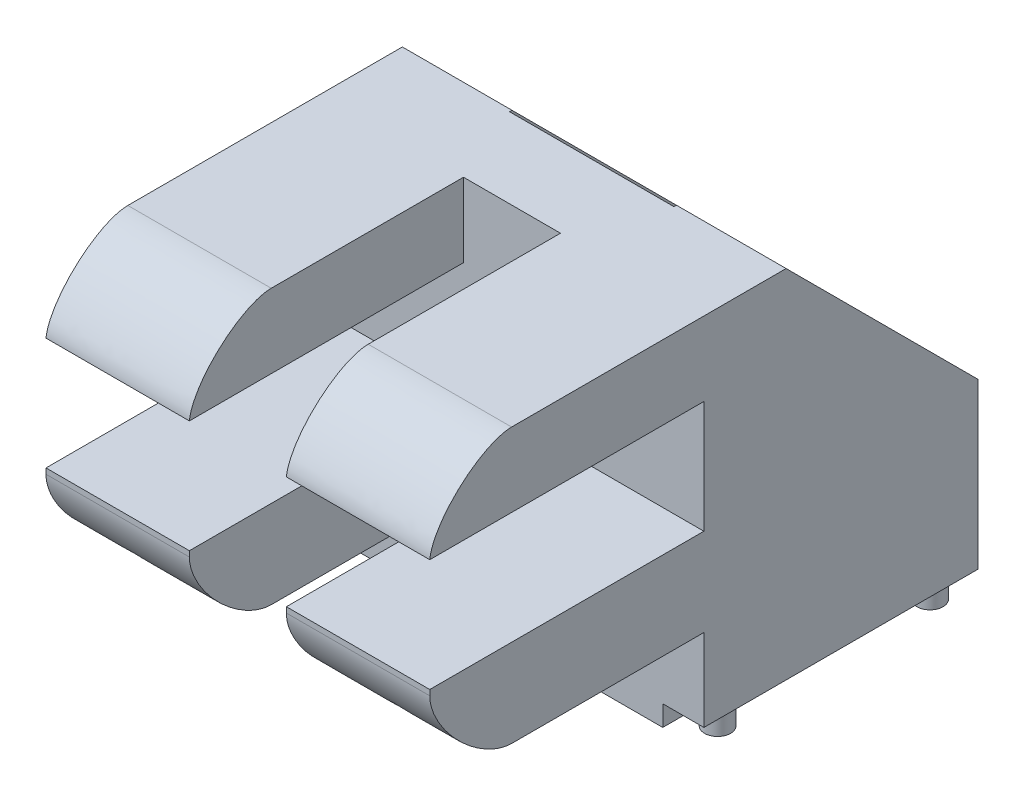
from build123d import *

# Parameters (mm, degrees)
ESQUISSE1_W             = 28
ESQUISSE1_H             = 20
BOSS_EXTRU_1_DEPTH      = 6
ESQUISSE3_W             = 12
ESQUISSE3_H             = 7
ENL_V_MAT_EXTRU_1_DEPTH = 35.928498393
ESQUISSE4_W             = 22
ESQUISSE4_H             = 3
BOSS_EXTRU_2_DEPTH      = 1.5
ESQUISSE5_R             = 0.95
BOSS_EXTRU_3_DEPTH      = 1.9
ESQUISSE6_R             = 0.95
BOSS_EXTRU_4_DEPTH      = 1.9
ESQUISSE12_W            = 28
ESQUISSE12_H            = 5.816034141
BOSS_EXTRU_5_DEPTH      = 20
ESQUISSE13_W            = 8
ESQUISSE13_H            = 14.813855777
BOSS_EXTRU_7_DEPTH      = 20
CHANFREIN4_SIZE         = 14
ESQUISSE15_W            = 10.461102818
ESQUISSE15_H            = 20
BOSS_EXTRU_8_DEPTH      = 20
ESQUISSE16_W            = 10.461102818
ESQUISSE16_H            = 8.2
ENL_V_MAT_EXTRU_2_DEPTH = 20
CONG_3_SIZE             = 6
CONG_4_START            = -29
CONG_4_DEPTH            = 11.461102818
SYM_TRIE3_START         = -8
SYM_TRIE3_DEPTH         = 8
SYM_TRIE3_START_2       = -10.461102818
SYM_TRIE3_2_DEPTH       = 2.461102818


with BuildPart() as part:
    # Esquisse1 → Boss.-Extru.1 (new body)
    with BuildSketch(Plane(origin=(0, 8, 0), x_dir=(1, 0, 0), z_dir=(0, 1, 0))):
        with Locations((-14, -10)):
            Rectangle(ESQUISSE1_W, ESQUISSE1_H)
    extrude(amount=BOSS_EXTRU_1_DEPTH)

    # Esquisse3 → Enlèv. mat.-Extru.1 (cut, through all)
    with BuildSketch(Plane(origin=(0, 14, 0), x_dir=(1, 0, 0), z_dir=(0, 1, 0))):
        with Locations((-14, -10.5)):
            Rectangle(ESQUISSE3_W, ESQUISSE3_H)
    extrude(amount=-ENL_V_MAT_EXTRU_1_DEPTH, mode=Mode.SUBTRACT)

    # Esquisse4 → Boss.-Extru.2 (add)
    with BuildSketch(Plane.XZ.offset(-8)):
        with Locations((-14, 18.5)):
            Rectangle(ESQUISSE4_W, ESQUISSE4_H)
    extrude(amount=BOSS_EXTRU_2_DEPTH)

    # Esquisse5 → Boss.-Extru.3 (add)
    with BuildSketch(Plane.XZ.offset(-8)):
        with Locations(Location((-1.75, 1.75, 0), (0, 0, 90))):
            Circle(ESQUISSE5_R)
    boss_extru_3 = extrude(amount=BOSS_EXTRU_3_DEPTH)

    # Esquisse6 → Boss.-Extru.4 (add)
    with BuildSketch(Plane.XZ.offset(-8)):
        with Locations(Location((-1.5, 17.5, 0), (0, 0, 90))):
            Circle(ESQUISSE6_R)
    boss_extru_4 = extrude(amount=BOSS_EXTRU_4_DEPTH)

    # Symétrie2: Boss.-Extru.3, Boss.-Extru.4 across plane
    add(boss_extru_3.mirror(Plane(origin=(-14, 0, 0), x_dir=(0, 0, 1), z_dir=(1, 0, 0))))
    add(boss_extru_4.mirror(Plane(origin=(-14, 0, 0), x_dir=(0, 0, 1), z_dir=(1, 0, 0))))

    # Esquisse12 → Boss.-Extru.5 (add)
    with BuildSketch(Plane(origin=(0, 14, 0), x_dir=(1, 0, 0), z_dir=(0, 1, 0))):
        with Locations((-14, -17.091982929)):
            Rectangle(ESQUISSE12_W, ESQUISSE12_H)
    extrude(amount=BOSS_EXTRU_5_DEPTH)

    # Esquisse13 → Boss.-Extru.7 (add)
    with BuildSketch(Plane(origin=(0, 14, 0), x_dir=(1, 0, 0), z_dir=(0, 1, 0))):
        with Locations((-24, -7.406927889)):
            Rectangle(ESQUISSE13_W, ESQUISSE13_H)
    extrude(amount=BOSS_EXTRU_7_DEPTH)

    # Chanfrein4
    chanfrein4_edges = [part.edges().sort_by_distance(p)[0] for p in [
        (-24, 34, 0),
    ]]
    chamfer(chanfrein4_edges, length=CHANFREIN4_SIZE)

    # Esquisse15 → Boss.-Extru.8 (add)
    with BuildSketch(Plane.XY.offset(20)):
        with Locations((-22.769448591, 24)):
            Rectangle(ESQUISSE15_W, ESQUISSE15_H)
    extrude(amount=BOSS_EXTRU_8_DEPTH)

    # Esquisse16 → Enlèv. mat.-Extru.2 (cut)
    with BuildSketch(Plane.XY.offset(40)):
        with Locations((-22.769448591, 24.5)):
            Rectangle(ESQUISSE16_W, ESQUISSE16_H)
    extrude(amount=-ENL_V_MAT_EXTRU_2_DEPTH, mode=Mode.SUBTRACT)

    # Congé3
    # a fillet whose section is not a circle: 6 mm, written as the material it takes off along each edge
    with BuildSketch(Plane(origin=(-2.538897182, 14, 40), x_dir=(0, 1, 0), z_dir=(-1, 0, 0))) as cong_3_piece_1:
        with BuildLine():
            Bezier((CONG_3_SIZE, 0), (0, 0), (0, CONG_3_SIZE), weights=[1, 0.424264069, 1])
            Line((0, CONG_3_SIZE), (0, 0))
            Line((0, 0), (CONG_3_SIZE, 0))
        make_face()
    extrude(amount=40.461102818, mode=Mode.SUBTRACT)

    # Congé4: read off the stored shape, not the designer's step
    # Congé4 outline → Congé4 (cut)
    with BuildSketch(Plane.YZ.offset(CONG_4_START)):
        with BuildLine():
            add(Edge.make_bspline(
                [(34, 34.030075377), (34, 39.45727958), (28.6, 40)],
                knots=[0, 0, 0, 1, 1, 1], degree=2, weights=[1, 0.444971909, 1]))
            Line((34, 34.030075377), (34, 40))
            Line((34, 40), (28.6, 40))
        make_face()
    extrude(amount=CONG_4_DEPTH, mode=Mode.SUBTRACT)

    # Symétrie3: read off the stored shape, not the designer's step
    # Symétrie3 outline → Symétrie3 (add)
    with BuildSketch(Plane.YZ.offset(SYM_TRIE3_START)):
        Polygon((34, 14), (34, 14.183965859), (14, 14.183965859), (14, 0), (20, 0), align=None)
        with BuildLine():
            Line((28.6, 40), (28.6, 20))
            Line((28.6, 20), (34, 20))
            Line((34, 20), (34, 34.030075377))
            add(Edge.make_bspline(
                [(28.6, 40), (34, 39.45727958), (34, 34.030075377)],
                knots=[0, 0, 0, 1, 1, 1], degree=2, weights=[1, 0.444971909, 1]))
        make_face()
        with BuildLine():
            add(Edge.make_bspline(
                [(14, 34), (14, 40), (20, 40)],
                knots=[0, 0, 0, 1, 1, 1], degree=2, weights=[1, 0.424264069, 1]))
            Line((14, 34), (14, 20))
            Line((14, 20), (20.4, 20))
            Line((20.4, 20), (20.4, 40))
            Line((20.4, 40), (20, 40))
        make_face()
    extrude(amount=SYM_TRIE3_DEPTH)

    # Sym_trie3 2 outline → Sym_trie3 2 (add)
    with BuildSketch(Plane.YZ.offset(SYM_TRIE3_START_2)):
        with BuildLine():
            Line((28.6, 40), (28.6, 20))
            Line((28.6, 20), (34, 20))
            Line((34, 20), (34, 34.030075377))
            add(Edge.make_bspline(
                [(28.6, 40), (34, 39.45727958), (34, 34.030075377)],
                knots=[0, 0, 0, 1, 1, 1], degree=2, weights=[1, 0.444971909, 1]))
        make_face()
        with BuildLine():
            add(Edge.make_bspline(
                [(14, 34), (14, 40), (20, 40)],
                knots=[0, 0, 0, 1, 1, 1], degree=2, weights=[1, 0.424264069, 1]))
            Line((14, 34), (14, 20))
            Line((14, 20), (20.4, 20))
            Line((20.4, 20), (20.4, 40))
            Line((20.4, 40), (20, 40))
        make_face()
    extrude(amount=SYM_TRIE3_2_DEPTH)


solid = part.part
